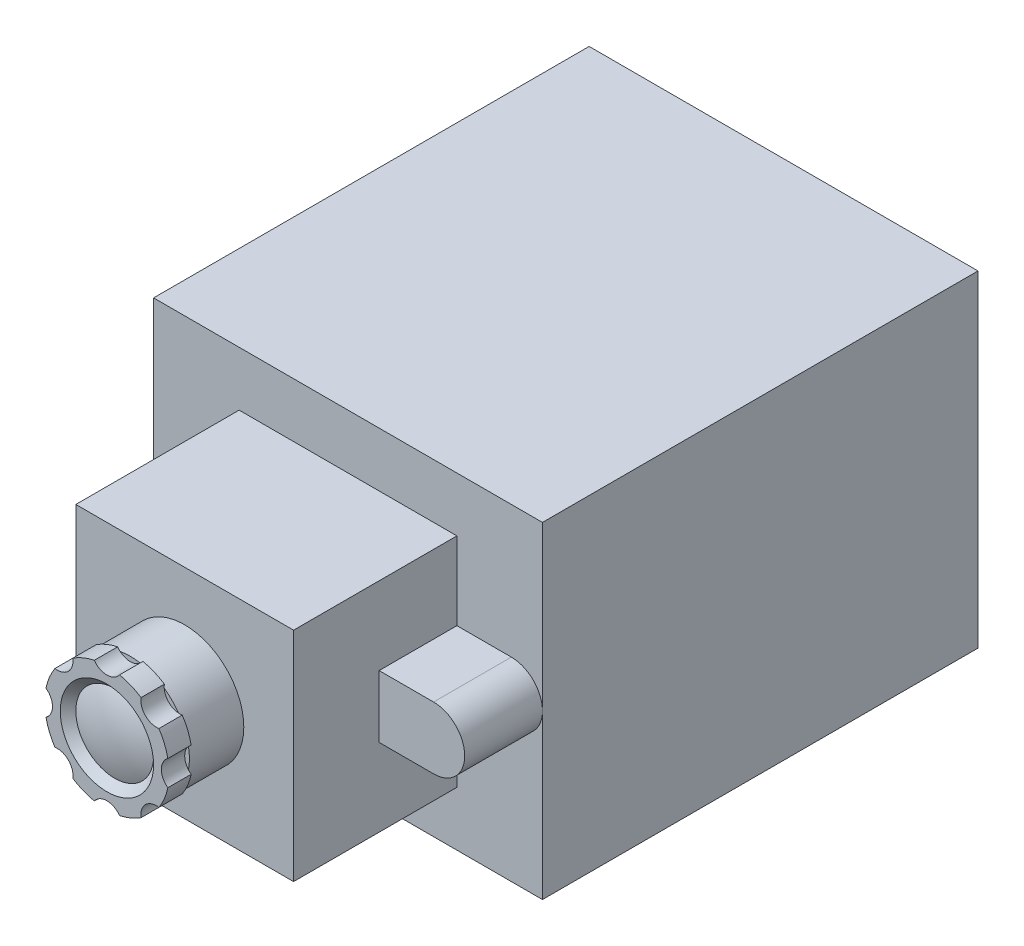
from build123d import *
from build123d.topology import SkipClean

# Parameters (mm, degrees)
SKETCH_1_W               = 14
SKETCH_1_H               = 14
EXTRUDE_1_DEPTH          = 10.5
SKETCH_2_R               = 3.8
EXTRUDE_2_DEPTH          = 5
SKETCH_3_R               = 4
EXTRUDE_3_DEPTH          = 1.5
SKETCH_4_R               = 1
CUT_EXTRUDE_2_DEPTH      = 1.5
PATTERN_CIRCULAR_1_COUNT = 8
SKETCH_5_W               = 25
SKETCH_5_H               = 21
EXTRUDE_4_DEPTH          = 28
EXTRUDE_5_DEPTH          = 5
SKETCH_9_R               = 3
CUT_EXTRUDE_3_DEPTH      = 0.5
CHAMFER_1_SIZE           = 0.5


with BuildPart() as part:
    # 草圖1 → 填料-伸長1 (new body)
    with BuildSketch(Plane.XY):
        Rectangle(SKETCH_1_W, SKETCH_1_H)
    extrude(amount=EXTRUDE_1_DEPTH)

    # 草圖2 → 填料-伸長2 (add)
    with BuildSketch(Plane.XY.offset(10.5)):
        Circle(SKETCH_2_R)
    extrude(amount=EXTRUDE_2_DEPTH)

    # 草圖3 → 填料-伸長3 (add)
    with BuildSketch(Plane.XY.offset(15.5)):
        Circle(SKETCH_3_R)
    extrude(amount=-EXTRUDE_3_DEPTH)

    # 草圖4 → 除料-伸長2 (cut)
    with BuildSketch(Plane.XY.offset(15.5)):
        with Locations((0, 4.5)):
            Circle(SKETCH_4_R)
    cut_extrude_2 = extrude(amount=-CUT_EXTRUDE_2_DEPTH, mode=Mode.SUBTRACT)

    # 環狀複製排列1: 除料-伸長2 ×8 about axis
    pattern_circular_1_axis = Axis((0, 0, 0), (0, 0, 1))
    for i in range(1, PATTERN_CIRCULAR_1_COUNT):
        add(cut_extrude_2.rotate(pattern_circular_1_axis, i * 360 / PATTERN_CIRCULAR_1_COUNT), mode=Mode.SUBTRACT)

    # 草圖5 → 填料-伸長4 (add)
    with BuildSketch(Plane(origin=(0, 0, 0), x_dir=(-1, 0, 0), z_dir=(0, 0, -1))):
        Rectangle(SKETCH_5_W, SKETCH_5_H)
    extrude(amount=EXTRUDE_4_DEPTH)

    # 草圖6 → 填料-伸長5 (add)
    with BuildSketch(Plane.XY):
        with BuildLine():
            Line((-7, -2), (-7, 2))
            Line((-7, 2), (-10.5, 2))
            ThreePointArc((-10.5, 2), (-12.5, 0), (-10.5, -2))
            Line((-10.5, -2), (-7, -2))
        make_face()
    extrude_5 = extrude(amount=EXTRUDE_5_DEPTH)

    # 鏡射1: 填料-伸長5 across plane
    add(extrude_5.mirror(Plane(origin=(0, 0, 0), x_dir=(0, 0, 1), z_dir=(1, 0, 0))))

    # 草圖9 → 除料-伸長3 (cut)
    with BuildSketch(Plane.XY.offset(15.5)):
        Circle(SKETCH_9_R)
    extrude(amount=-CUT_EXTRUDE_3_DEPTH, mode=Mode.SUBTRACT)

    # 導角1
    chamfer_1_edges = [part.edges().sort_by_distance(p)[0] for p in [
        (-3, 0, 15),
    ]]
    chamfer(chamfer_1_edges, length=CHAMFER_1_SIZE - 0.0001)  # a hair under: the kernel refuses the full size

    # 草圖10 → 旋轉2 (revolve)
    with SkipClean():  # the faces are left unmerged after this step: merging them gives an invalid solid
        with BuildSketch(Plane(origin=(0, 0, 0), x_dir=(1, 0, 0), z_dir=(0, 1, 0)), mode=Mode.PRIVATE) as revolve_2_sk:
            with BuildLine():
                Line((2.5, -15), (0, -15))
                Line((0, -15), (0, -15.5))
                ThreePointArc((0, -15.5), (1.274754878, -15.373774392), (2.5, -15))
            make_face()
            with BuildLine():
                Line((0, -15.5), (0, -15))
                Line((0, -15), (-2.5, -15))
                ThreePointArc((-2.5, -15), (-1.274754878, -15.373774392), (0, -15.5))
            make_face()
        revolve(revolve_2_sk.sketch.rotate(Axis((0, 0, 0), (0, 0, 1)), 170.092802055), axis=Axis((0, 0, 0), (0, 0, 1)))
    add(part.part.scale(1), mode=Mode.REPLACE)  # the faces are merged on a copy


solid = part.part
